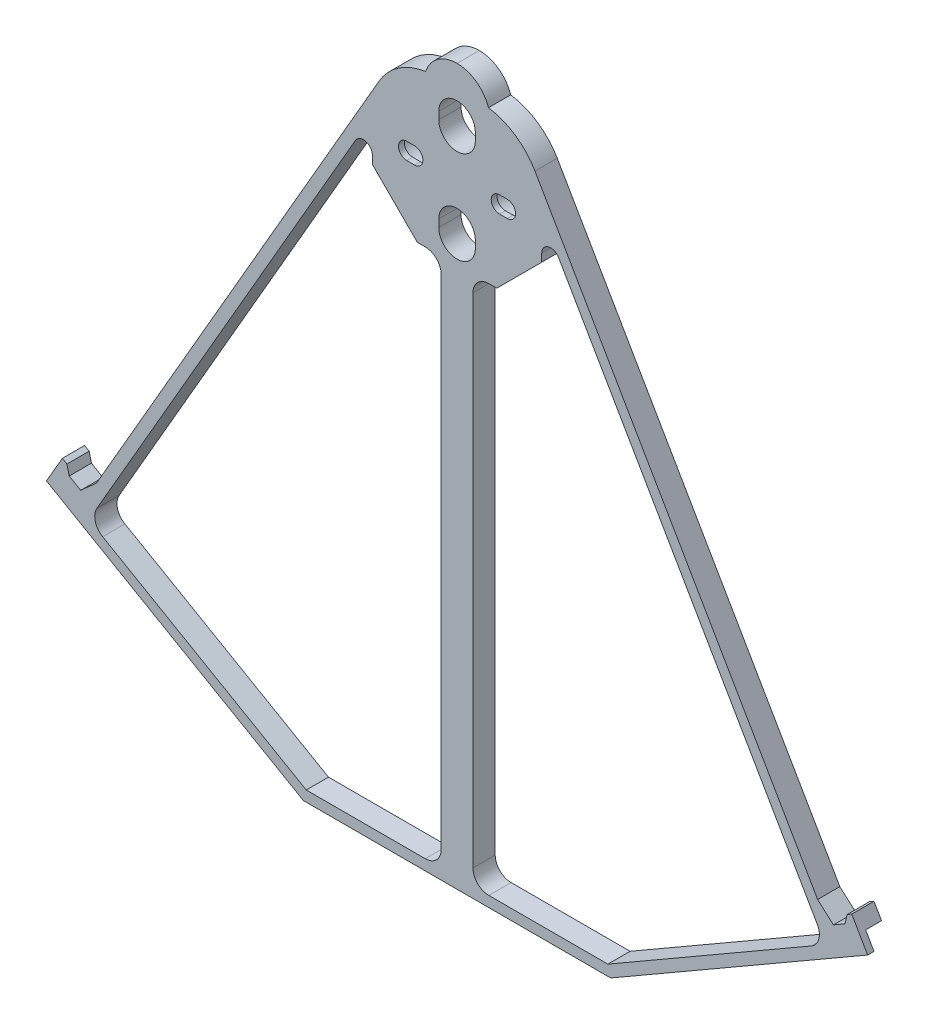
from build123d import *

# Parameters (mm, degrees)
SALIENTE_EXTRUIR1_DEPTH    = 4.2
CORTAR_EXTRUIR1_DEPTH      = 4.2
CORTAR_EXTRUIR2_DEPTH      = 4.2
CORTAR_EXTRUIR3_START      = -3.1
CORTAR_EXTRUIR3_DEPTH      = 3.1
CORTAR_EXTRUIR4_DEPTH      = 156.719268273
CORTAR_EXTRUIR4_DEPTH_BACK = 3
CORTAR_EXTRUIR5_DEPTH      = 156.719268273


with BuildPart() as part:
    # Croquis1 → Saliente-Extruir1 (new body)
    with BuildSketch(Plane.XY):
        Polygon((-29, 0), (0, 0), (0, 135), (-8.793796291, 134.998171452), (-68.052260592, 32.359500504), (-71.038140766, 29.697824418), (-73.203204276, 30.947824418), (-73.631397208, 32.696152423), (-74.497422612, 33.196152423), (-77.497422612, 28), align=None)
    extrude(amount=SALIENTE_EXTRUIR1_DEPTH)

    # Croquis2 → Cortar-Extruir1 (cut)
    with BuildSketch(Plane.XY.offset(4.2)):
        with BuildLine():
            Line((-28.464101615, 2), (-6, 2))
            ThreePointArc((-6, 2), (-3.878679656, 2.878679656), (-3, 5))
            Line((-3, 5), (-3, 99))
            ThreePointArc((-3, 99), (-3.878679656, 101.121320344), (-6, 102))
            Line((-6, 102), (-7.5, 102))
            Line((-7.5, 102), (-15.985281374, 110.485281374))
            Line((-15.985281374, 110.485281374), (-15.985281374, 111.985281374))
            ThreePointArc((-15.985281374, 111.985281374), (-17.247748826, 113.63056104), (-19.163717591, 112.836940891))
            Line((-19.163717591, 112.836940891), (-67.982616962, 28.28012681))
            ThreePointArc((-67.982616962, 28.28012681), (-68.282318046, 26.003669651), (-66.884540421, 24.182050687))
            Line((-66.884540421, 24.182050687), (-28.464101615, 2))
        make_face()
    extrude(amount=-CORTAR_EXTRUIR1_DEPTH, mode=Mode.SUBTRACT)

    # Croquis3 → Cortar-Extruir2 (cut)
    with BuildSketch(Plane.XY.offset(4.2)):
        with BuildLine():
            ThreePointArc((-3.45, 124.05), (-2.439518395, 121.610481605), (0, 120.6))
            Line((0, 120.6), (0, 128.9))
            ThreePointArc((0, 128.9), (-2.439518395, 127.889518395), (-3.45, 125.45))
            Line((-3.45, 125.45), (-3.45, 124.05))
        make_face()
        with BuildLine():
            Line((-3.45, 107.85), (-3.45, 106.45))
            ThreePointArc((-3.45, 106.45), (-2.439518395, 104.010481605), (0, 103))
            Line((0, 103), (0, 111.3))
            ThreePointArc((0, 111.3), (-2.439518395, 110.289518395), (-3.45, 107.85))
        make_face()
        with BuildLine():
            ThreePointArc((-9.475, 117.525), (-11.05, 115.95), (-9.475, 114.375))
            Line((-9.475, 114.375), (-8.025, 114.375))
            ThreePointArc((-8.025, 114.375), (-6.45, 115.95), (-8.025, 117.525))
            Line((-8.025, 117.525), (-9.475, 117.525))
        make_face()
    extrude(amount=-CORTAR_EXTRUIR2_DEPTH, mode=Mode.SUBTRACT)

    # Croquis4 → Cortar-Extruir3 (cut)
    with BuildSketch(Plane(origin=(0, 0, 0), x_dir=(-1, 0, 0), z_dir=(0, 0, -1)).offset(CORTAR_EXTRUIR3_START)):
        with BuildLine():
            ThreePointArc((8.05, 119.4), (4.6, 115.95), (8.05, 112.5))
            Line((8.05, 112.5), (9.45, 112.5))
            ThreePointArc((9.45, 112.5), (12.9, 115.95), (9.45, 119.4))
            Line((9.45, 119.4), (8.05, 119.4))
        make_face()
        with BuildLine():
            Line((8.025, 117.525), (9.475, 117.525))
            ThreePointArc((9.475, 117.525), (11.05, 115.95), (9.475, 114.375))
            Line((9.475, 114.375), (8.025, 114.375))
            ThreePointArc((8.025, 114.375), (6.45, 115.95), (8.025, 117.525))
        make_face(mode=Mode.SUBTRACT)
    extrude(amount=CORTAR_EXTRUIR3_DEPTH, mode=Mode.SUBTRACT)

    # Croquis5 → Cortar-Extruir4 (cut, two sides: drawn at the far end of the back side and taken through both)
    with BuildSketch(Plane(origin=(0, 0, 0), x_dir=(-1, 0, 0), z_dir=(0, 0, -1)).offset(-CORTAR_EXTRUIR4_DEPTH_BACK)):
        Polygon((312.647110497, 167.401042296), (75.922422612, 30.727980022), (71.289186702, 28.052980022), (72.864186702, 25.325), (209.537248976, -211.399687885), (737.036585646, -354.985428944), (840.146447168, 23.815301238), align=None)
    extrude(amount=CORTAR_EXTRUIR4_DEPTH + CORTAR_EXTRUIR4_DEPTH_BACK, mode=Mode.SUBTRACT)

    # Simetría2: part across plane


with BuildPart() as part_1:
    add(part.part)
    add(part.part.mirror(Plane(origin=(0, 0, 4.2), x_dir=(0, 0, 1), z_dir=(-1, 0, 0))))

    # Croquis7 → Cortar-Extruir5 (cut, through all)
    with BuildSketch(Plane.XY.offset(4.2)):
        with BuildLine():
            Line((8.793796291, 134.998171452), (0, 135))
            ThreePointArc((0, 135), (3.658451804, 133.816445156), (5.930432994, 130.714321183))
            ThreePointArc((5.930432994, 130.714321183), (11.003838282, 128.738100788), (14.710580838, 124.75))
            Line((14.710580838, 124.75), (8.793796291, 134.998171452))
        make_face()
        with BuildLine():
            Line((-8.793796291, 134.998171452), (-14.710580838, 124.75))
            ThreePointArc((-14.710580838, 124.75), (-11.003838282, 128.738100788), (-5.930432994, 130.714321183))
            ThreePointArc((-5.930432994, 130.714321183), (-3.658451804, 133.816445156), (0, 135))
            Line((0, 135), (-8.793796291, 134.998171452))
        make_face()
    extrude(amount=-CORTAR_EXTRUIR5_DEPTH, mode=Mode.SUBTRACT)


solid = part_1.part
